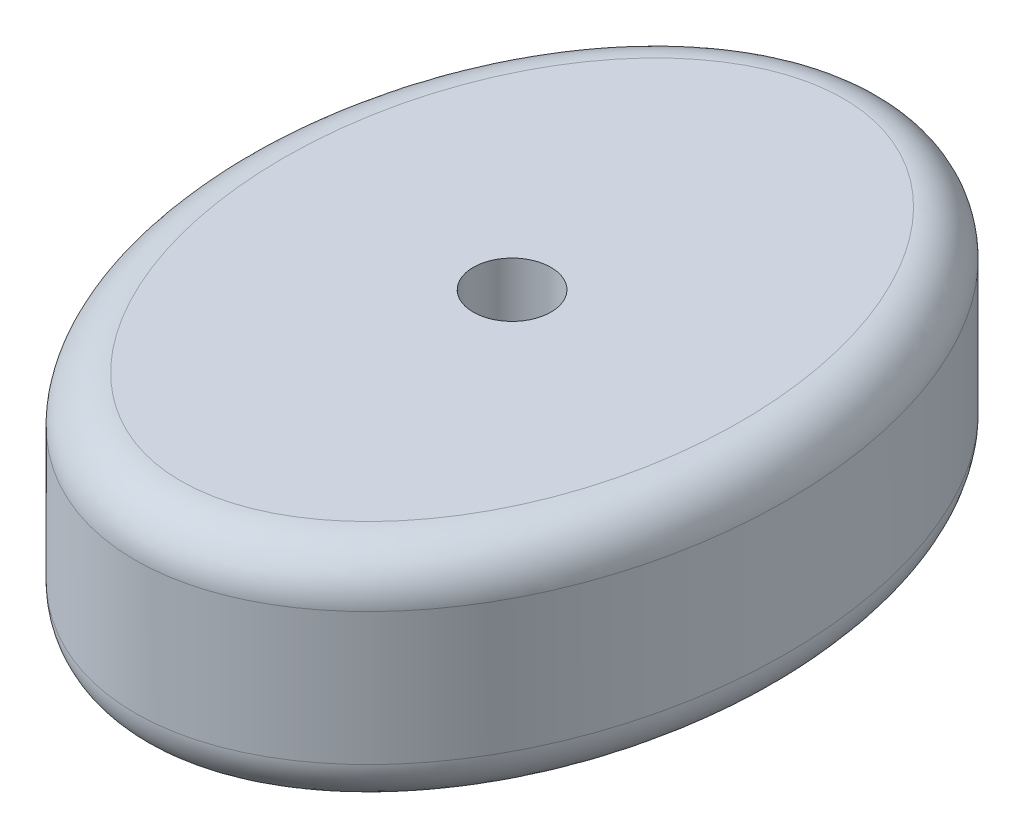
from build123d import *

# Parameters (mm, degrees)
SKETCH1_RX          = 8.25
SKETCH1_RY          = 6
SKETCH1_R           = 1.975
BOSS_EXTRUDE1_DEPTH = 2.4
SKETCH2_RX          = 8.25
SKETCH2_RY          = 6
SKETCH2_R           = 0.85
BOSS_EXTRUDE2_DEPTH = 2.5
FILLET1_R           = 1


with BuildPart() as part:
    # Sketch1 → Boss-Extrude1 (new body)
    with BuildSketch(Plane(origin=(0, 0, 0), x_dir=(1, 0, 0), z_dir=(0, 1, 0))):
        with Locations(Location((0, 0), (0, 0, 90))):
            Ellipse(SKETCH1_RX, SKETCH1_RY)
        Circle(SKETCH1_R, mode=Mode.SUBTRACT)
    extrude(amount=BOSS_EXTRUDE1_DEPTH)

    # Sketch2 → Boss-Extrude2 (add)
    with BuildSketch(Plane(origin=(0, 2.4, 0), x_dir=(1, 0, 0), z_dir=(0, 1, 0))):
        with Locations(Location((0, 0), (0, 0, 90))):
            Ellipse(SKETCH2_RX, SKETCH2_RY)
        Circle(SKETCH2_R, mode=Mode.SUBTRACT)
    extrude(amount=BOSS_EXTRUDE2_DEPTH)

    # Fillet1
    fillet1_edges = [part.edges().sort_by_distance(p)[0] for p in [
        (0.002911053, 0, 8.249999029),
        (0.002911053, 4.9, 8.249999029),
    ]]
    fillet(fillet1_edges, radius=FILLET1_R)


solid = part.part
